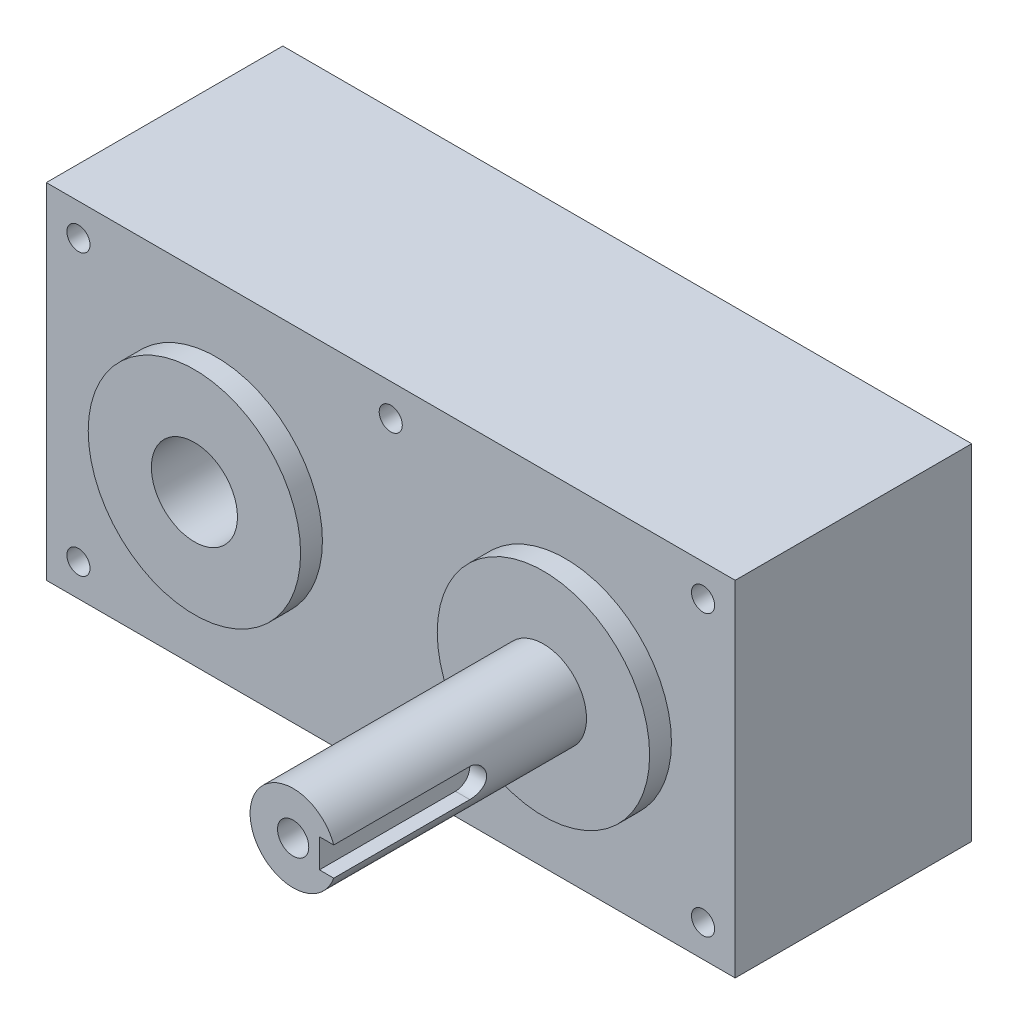
from build123d import *

# Parameters (mm, degrees)
SKETCH1_W                        = 152.4
SKETCH1_H                        = 76.2
BOSS_EXTRUDE1_DEPTH              = 52.324
F_1_4_20_TAPPED_HOLE1_AT_2_COUNT = 2
F_1_4_20_TAPPED_HOLE1_AT_2_PITCH = 69.088
F_1_4_20_TAPPED_HOLE1_AT_3_COUNT = 2
F_1_4_20_TAPPED_HOLE1_AT_3_PITCH = 69.088
SKETCH4_R                        = 23.495
BOSS_EXTRUDE2_DEPTH              = 4.826
SKETCH5_R                        = 9.525
BOSS_EXTRUDE3_DEPTH              = 60.198
CUT_EXTRUDE1_START               = -33.274
CUT_EXTRUDE1_DEPTH               = 33.274
FILLET1_R                        = 3.175
SKETCH7_R                        = 9.525
CUT_EXTRUDE2_DEPTH               = 180.717340566
F_5_16_24_TAPPED_HOLE1_D         = 6.9088
F_5_16_24_TAPPED_HOLE1_DEPTH     = 19.06
F_5_16_24_TAPPED_HOLE1_TIP       = 2.075612922


with BuildPart() as part:
    # Sketch1 → Boss-Extrude1 (new body)
    with BuildSketch(Plane.XY):
        with Locations((76.2, 38.1)):
            Rectangle(SKETCH1_W, SKETCH1_H)
    extrude(amount=BOSS_EXTRUDE1_DEPTH)

    # Sketch2 → 1/4-20 Tapped Hole1 (revolve, cut)
    with BuildSketch(Plane(origin=(76.2, 69.088, 52.324), x_dir=(0, -1, 0), z_dir=(1, 0, 0))):
        Polygon((0, 0), (0, 18.043816902), (2.5527, 16.51), (2.5527, 0), align=None)
    f_1_4_20_tapped_hole1 = revolve(axis=Axis((76.2, 69.088, 58.674), (0, 0, -1)), mode=Mode.SUBTRACT)

    # 1/4-20 Tapped Hole1 at 2: 1/4-20 Tapped Hole1 ×2
    with Locations(*[(-i * F_1_4_20_TAPPED_HOLE1_AT_2_PITCH, 0, 0) for i in range(1, F_1_4_20_TAPPED_HOLE1_AT_2_COUNT)]):
        add(f_1_4_20_tapped_hole1, mode=Mode.SUBTRACT)

    # 1/4-20 Tapped Hole1 at 3: 1/4-20 Tapped Hole1 ×2
    with Locations(*[(i * F_1_4_20_TAPPED_HOLE1_AT_3_PITCH, 0, 0) for i in range(1, F_1_4_20_TAPPED_HOLE1_AT_3_COUNT)]):
        add(f_1_4_20_tapped_hole1, mode=Mode.SUBTRACT)

    # Mirror1: 1/4-20 Tapped Hole1 across plane
    add(f_1_4_20_tapped_hole1.mirror(Plane.ZX.offset(38.1)), mode=Mode.SUBTRACT)

    # Mirror1 copy 1 sketch → Mirror1 copy 1 (revolve, cut)
    with BuildSketch(Plane(origin=(7.112, 7.112, 52.324), x_dir=(0, 1, 0), z_dir=(1, 0, 0))):
        Polygon((0, 0), (0, -18.043816902), (2.5527, -16.51), (2.5527, 0), align=None)
    revolve(axis=Axis((7.112, 7.112, 58.674), (0, 0, 1)), mode=Mode.SUBTRACT)

    # Mirror1 copy 2 sketch → Mirror1 copy 2 (revolve, cut)
    with BuildSketch(Plane(origin=(145.288, 7.112, 52.324), x_dir=(0, 1, 0), z_dir=(1, 0, 0))):
        Polygon((0, 0), (0, -18.043816902), (2.5527, -16.51), (2.5527, 0), align=None)
    revolve(axis=Axis((145.288, 7.112, 58.674), (0, 0, 1)), mode=Mode.SUBTRACT)

    # Sketch4 → Boss-Extrude2 (add)
    with BuildSketch(Plane.XY.offset(52.324)):
        with Locations(Location((37.592, 38.1, 0), (0, 0, 180))):
            Circle(SKETCH4_R)
        with Locations(Location((114.808, 38.1, 0), (0, 0, 180))):
            Circle(SKETCH4_R)
    extrude(amount=BOSS_EXTRUDE2_DEPTH)

    # Sketch5 → Boss-Extrude3 (add)
    with BuildSketch(Plane.XY.offset(52.324)):
        with Locations(Location((114.808, 38.1, 0), (0, 0, 180))):
            Circle(SKETCH5_R)
    extrude(amount=BOSS_EXTRUDE3_DEPTH)

    # Sketch6 → Cut-Extrude1 (cut)
    with BuildSketch(Plane.XY.offset(112.522).offset(CUT_EXTRUDE1_START)):
        with BuildLine():
            Line((120.613256121, 34.925), (120.613256121, 41.275))
            Line((120.613256121, 41.275), (123.788256121, 41.275))
            ThreePointArc((123.788256121, 41.275), (124.333, 38.1), (123.788256121, 34.925))
            Line((123.788256121, 34.925), (120.613256121, 34.925))
        make_face()
    extrude(amount=CUT_EXTRUDE1_DEPTH, mode=Mode.SUBTRACT)

    # Fillet1
    fillet1_edges = [part.edges().sort_by_distance(p)[0] for p in [
        (122.200756121, 41.275, 79.248),
        (122.200756121, 34.925, 79.248),
    ]]
    fillet(fillet1_edges, radius=FILLET1_R - 0.0001)  # a hair under: the kernel refuses the full size

    # Sketch7 → Cut-Extrude2 (cut, through all)
    with BuildSketch(Plane.XY.offset(57.15)):
        with Locations((37.592, 38.1)):
            Circle(SKETCH7_R)
    extrude(amount=-CUT_EXTRUDE2_DEPTH, mode=Mode.SUBTRACT)

    # 5/16-24 Tapped Hole1
    with Locations(Plane.XY.offset(112.522)):
        with Locations((114.808, 38.1)):
            Hole(F_5_16_24_TAPPED_HOLE1_D / 2, depth=F_5_16_24_TAPPED_HOLE1_DEPTH)
            with Locations((0, 0, -(F_5_16_24_TAPPED_HOLE1_DEPTH + F_5_16_24_TAPPED_HOLE1_TIP / 2))):  # 118° drill point
                Cone(0, F_5_16_24_TAPPED_HOLE1_D / 2, F_5_16_24_TAPPED_HOLE1_TIP, mode=Mode.SUBTRACT)


solid = part.part
